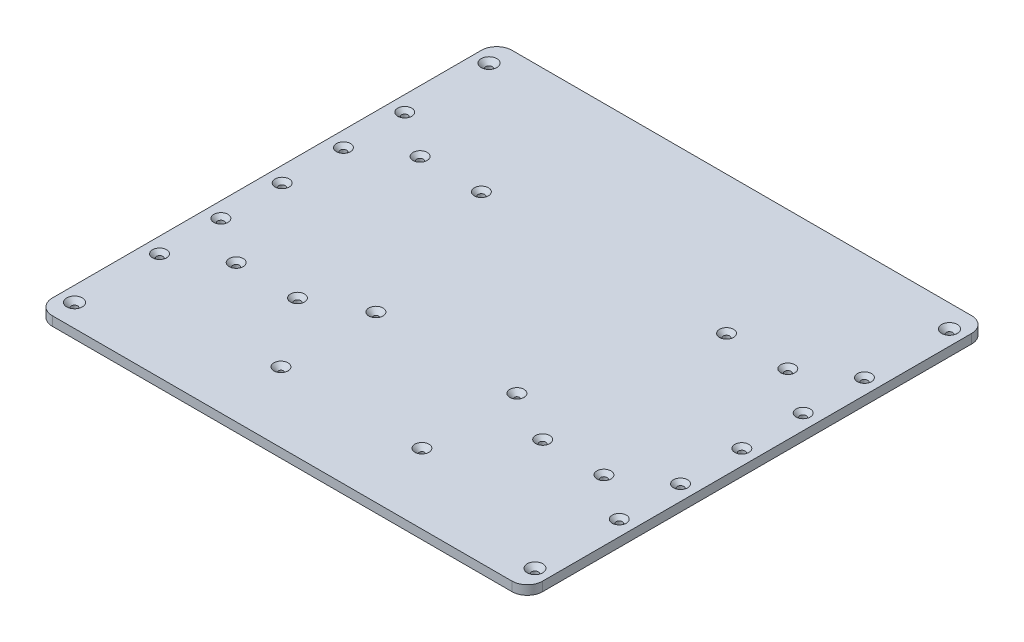
from build123d import *

# Parameters (mm, degrees)
EXTRUDE_1_DEPTH     = 3
SKETCH_5_R          = 2.1
CUT_EXTRUDE_4_DEPTH = 240
CHAMFER_2_SIZE      = 2.5
SKETCH_6_R          = 2.1
CUT_EXTRUDE_5_DEPTH = 10
CHAMFER_3_SIZE      = 3
SKETCH_7_R          = 2.1
CUT_EXTRUDE_6_DEPTH = 10
CHAMFER_4_SIZE      = 3
SKETCH_8_W          = 25.785951324
SKETCH_8_H          = 14.972487866
EXTRUDE_2_DEPTH     = 6
SKETCH_9_R          = 1.6
CUT_EXTRUDE_7_DEPTH = 10
CHAMFER_5_SIZE      = 3


with BuildPart() as part:
    # 草图1 → 凸台-拉伸1 (new, symmetric)
    with BuildSketch(Plane(origin=(0, 0, 0), x_dir=(1, 0, 0), z_dir=(0, 1, 0))):
        with BuildLine():
            Line((-150, -150), (150, -150))
            ThreePointArc((150, -150), (157.071067812, -147.071067812), (160, -140))
            Line((160, -140), (160, 140))
            ThreePointArc((160, 140), (157.071067812, 147.071067812), (150, 150))
            Line((150, 150), (-150, 150))
            ThreePointArc((-150, 150), (-157.071067812, 147.071067812), (-160, 140))
            Line((-160, 140), (-160, -140))
            ThreePointArc((-160, -140), (-157.071067812, -147.071067812), (-150, -150))
        make_face()
    extrude(amount=EXTRUDE_1_DEPTH, both=True)

    # 草图5 → 切除-拉伸4 (cut)
    with BuildSketch(Plane(origin=(0, 3, 0), x_dir=(1, 0, 0), z_dir=(0, 1, 0))):
        with Locations((80, 60)):
            Circle(SKETCH_5_R)
        with Locations((120, 60)):
            Circle(SKETCH_5_R)
        with Locations((-120, 60)):
            Circle(SKETCH_5_R)
        with Locations((-80, 60)):
            Circle(SKETCH_5_R)
        with Locations((-80, -60)):
            Circle(SKETCH_5_R)
        with Locations((-120, -60)):
            Circle(SKETCH_5_R)
        with Locations((120, -60)):
            Circle(SKETCH_5_R)
        with Locations((80, -60)):
            Circle(SKETCH_5_R)
        with Locations((-150, 0)):
            Circle(SKETCH_5_R)
        with Locations((-150, -40)):
            Circle(SKETCH_5_R)
        with Locations((-150, -80)):
            Circle(SKETCH_5_R)
        with Locations((-150, 80)):
            Circle(SKETCH_5_R)
        with Locations((-150, 40)):
            Circle(SKETCH_5_R)
        with Locations((150, 40)):
            Circle(SKETCH_5_R)
        with Locations((150, 80)):
            Circle(SKETCH_5_R)
        with Locations((150, -80)):
            Circle(SKETCH_5_R)
        with Locations((150, -40)):
            Circle(SKETCH_5_R)
        with Locations((150, 0)):
            Circle(SKETCH_5_R)
    extrude(amount=-CUT_EXTRUDE_4_DEPTH, mode=Mode.SUBTRACT)

    # 倒角2
    chamfer_2_edges = [part.edges().sort_by_distance(p)[0] for p in [
        (147.9, 3, 40),
        (147.9, 3, 80),
        (117.9, 3, 60),
        (77.9, 3, 60),
        (-82.1, 3, 60),
        (-122.1, 3, 60),
        (-152.1, 3, 80),
        (-152.1, 3, 40),
        (-152.1, 3, 0),
        (-152.1, 3, -40),
        (-152.1, 3, -80),
        (-122.1, 3, -60),
        (-82.1, 3, -60),
        (147.9, 3, 0),
        (147.9, 3, -40),
        (77.9, 3, -60),
        (117.9, 3, -60),
        (147.9, 3, -80),
    ]]
    chamfer(chamfer_2_edges, length=CHAMFER_2_SIZE)

    # 草图6 → 切除-拉伸5 (cut)
    with BuildSketch(Plane(origin=(0, 3, 0), x_dir=(1, 0, 0), z_dir=(0, 1, 0))):
        with Locations((-150.25, 135.25)):
            Circle(SKETCH_6_R)
        with Locations((150.25, 135.25)):
            Circle(SKETCH_6_R)
        with Locations((150.25, -135.25)):
            Circle(SKETCH_6_R)
        with Locations((-150.25, -135.25)):
            Circle(SKETCH_6_R)
    extrude(amount=-CUT_EXTRUDE_5_DEPTH, mode=Mode.SUBTRACT)

    # 倒角3
    chamfer_3_edges = [part.edges().sort_by_distance(p)[0] for p in [
        (148.15, 3, 135.25),
        (148.15, 3, -135.25),
        (-152.35, 3, -135.25),
        (-152.35, 3, 135.25),
    ]]
    chamfer(chamfer_3_edges, length=CHAMFER_3_SIZE)

    # 草图7 → 切除-拉伸6 (cut)
    with BuildSketch(Plane(origin=(0, -3, 0), x_dir=(-1, 0, 0), z_dir=(0, -1, 0))):
        with Locations((125, -100)):
            Circle(SKETCH_7_R)
    extrude(amount=-CUT_EXTRUDE_6_DEPTH, mode=Mode.SUBTRACT)

    # 倒角4
    chamfer_4_edges = [part.edges().sort_by_distance(p)[0] for p in [
        (-122.9, 3, 100),
    ]]
    chamfer(chamfer_4_edges, length=CHAMFER_4_SIZE)

    # 草图8 → 凸台-拉伸2 (add)
    with BuildSketch(Plane(origin=(0, 3, 0), x_dir=(1, 0, 0), z_dir=(0, 1, 0))):
        with Locations((-123.655101913, -100.590238672)):
            Rectangle(SKETCH_8_W, SKETCH_8_H)
    extrude(amount=-EXTRUDE_2_DEPTH)

    # 草图9 → 切除-拉伸7 (cut)
    with BuildSketch(Plane.XZ.offset(3)):
        with Locations((45.515326075, 104.314544866)):
            Circle(SKETCH_9_R)
        with Locations((45.515326075, 42.314544866)):
            Circle(SKETCH_9_R)
        with Locations((-46.484673925, 42.314544866)):
            Circle(SKETCH_9_R)
        with Locations((-46.484673925, 104.314544866)):
            Circle(SKETCH_9_R)
    extrude(amount=-CUT_EXTRUDE_7_DEPTH, mode=Mode.SUBTRACT)

    # 倒角5
    chamfer_5_edges = [part.edges().sort_by_distance(p)[0] for p in [
        (-48.084673925, 3, 104.314544866),
        (-48.084673925, 3, 42.314544866),
        (43.915326075, 3, 104.314544866),
        (43.915326075, 3, 42.314544866),
    ]]
    chamfer(chamfer_5_edges, length=CHAMFER_5_SIZE)


solid = part.part
